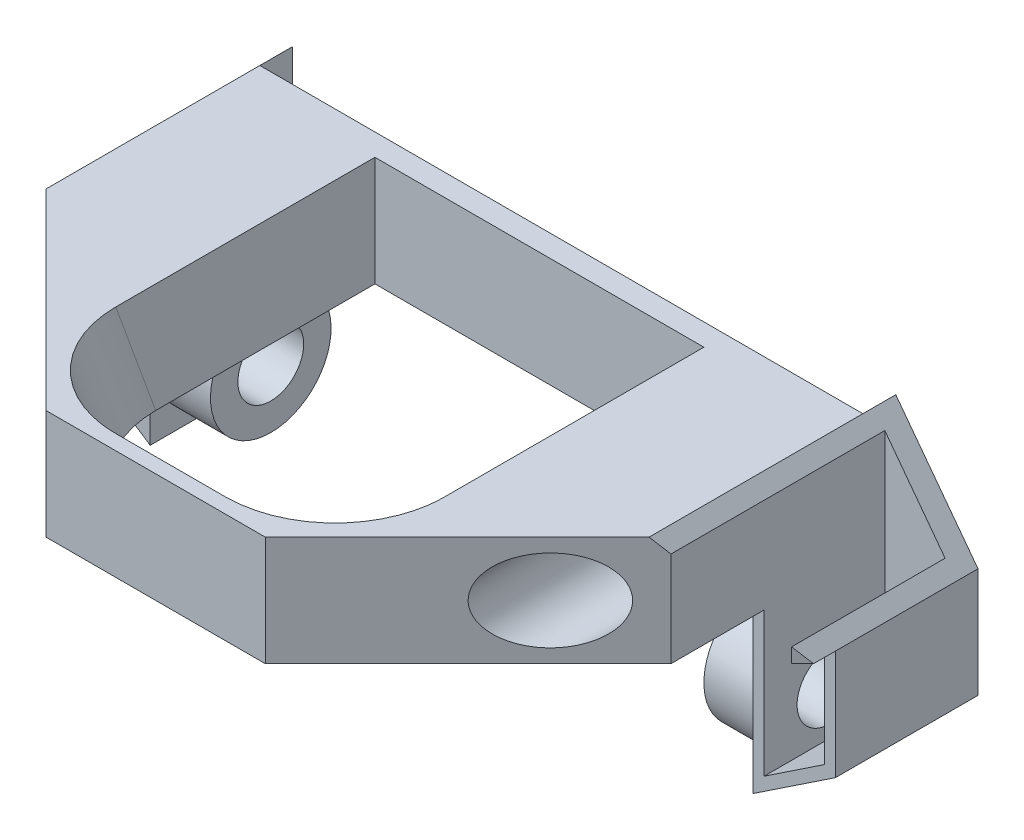
from build123d import *

# Parameters (mm, degrees)
BOSS_EXTRUDE1_DEPTH      = 40
CHAMFER1_SIZE            = 25
SKETCH3_W                = 55
SKETCH3_H                = 30.849850196
CUT_EXTRUDE2_DEPTH       = 3
SKETCH5_R                = 1.75
CUT_EXTRUDE4_DEPTH       = 56.226805086
CUT_EXTRUDE3_DEPTH       = 38
SKETCH6_R                = 5.5
SKETCH6_R_2              = 3
BOSS_EXTRUDE2_DEPTH      = 5
CUT_EXTRUDE5_START       = -2
SKETCH7_R                = 3
CUT_EXTRUDE5_DEPTH       = 2
SKETCH9_R                = 3.75
CUT_EXTRUDE7_DEPTH       = 24
SKETCH10_W               = 80.05733418
SKETCH10_H               = 23.210803027
CUT_EXTRUDE8_DEPTH       = 27
BOSS_EXTRUDE3_REACH      = 57.227
BOSS_EXTRUDE3_END_RADIUS = 5.5
SKETCH13_W               = 5
SKETCH13_H               = 8
SKETCH14_W               = 8.301356979
SKETCH14_H               = 17.411858477
CUT_EXTRUDE9_DEPTH       = 38
SKETCH15_W               = 30
SKETCH15_H               = 2
BOSS_EXTRUDE4_DEPTH      = 10


with BuildPart() as part:
    # Sketch1 → Boss-Extrude1 (new body)
    with BuildSketch(Plane.XY):
        Polygon((-27.5, 0), (27.5, 0), (27.5, -15), (35, -10), (35, 0), (27.5, 10), (-27.5, 10), (-35, 0), (-35, -10), (-27.5, -15), align=None)
    extrude(amount=BOSS_EXTRUDE1_DEPTH)

    # Chamfer1
    # the kernel refuses this chamfer: 25 mm, written as the material it takes off along each edge
    with BuildSketch(Plane(origin=(35, -74.292074699, 40), x_dir=(0.027495876610586317, 0, -0.9996219169112966), z_dir=(0, 1, 0)), Plane(origin=(-35, 64.292074699, 40), x_dir=(-0.027495876610586317, 0, -0.9996219169112966), z_dir=(0, -1, 0))) as chamfer1_piece_1:
        Polygon((CHAMFER1_SIZE * 0.999621916911, CHAMFER1_SIZE * 0.0274958766106), (-CHAMFER1_SIZE * 0.0274958766106, CHAMFER1_SIZE * 0.999621916911), (0, 0), align=None)
    extrude(amount=138.584149398, mode=Mode.SUBTRACT)

    # Sketch3 → Cut-Extrude2 (cut)
    with BuildSketch(Plane(origin=(0, 0, 0), x_dir=(-1, 0, 0), z_dir=(0, 0, -1))):
        Rectangle(SKETCH3_W, SKETCH3_H)
    extrude(amount=-CUT_EXTRUDE2_DEPTH, mode=Mode.SUBTRACT)

    # Sketch5 → Cut-Extrude4 (cut, through all)
    with BuildSketch(Plane(origin=(0, 0, 0), x_dir=(-1, 0, 0), z_dir=(0, 0, -1))):
        with Locations(Location((-23, 5, 0), (0, 0, 180))):
            Circle(SKETCH5_R)
        with Locations((23, 5)):
            Circle(SKETCH5_R)
    extrude(amount=-CUT_EXTRUDE4_DEPTH, mode=Mode.SUBTRACT)

    # Sketch4 → Cut-Extrude3 (cut)
    with BuildSketch(Plane.XY.offset(40)):
        Polygon((-34, 1.333333333), (-28.5, 8.666666667), (-28.5, -13.131482908), (-34, -9.464816242), align=None)
    cut_extrude3 = extrude(amount=-CUT_EXTRUDE3_DEPTH, mode=Mode.SUBTRACT)

    # Sketch6 → Boss-Extrude2 (add)
    with BuildSketch(Plane(origin=(-27.5, 0, 0), x_dir=(0, 0, -1), z_dir=(1, 0, 0))):
        with Locations(Location((-7, -9, 0), (0, 0, 180))):
            Circle(SKETCH6_R)
        with Locations((-7, -9)):
            Circle(SKETCH6_R_2, mode=Mode.SUBTRACT)
    boss_extrude2 = extrude(amount=BOSS_EXTRUDE2_DEPTH)

    # Sketch7 → Cut-Extrude5 (cut)
    with BuildSketch(Plane(origin=(-27.5, 0, 0), x_dir=(0, 0, -1), z_dir=(1, 0, 0)).offset(CUT_EXTRUDE5_START)):
        with Locations((-7, -9)):
            Circle(SKETCH7_R)
    cut_extrude5 = extrude(amount=CUT_EXTRUDE5_DEPTH, mode=Mode.SUBTRACT)

    # Mirror1: Cut-Extrude3, Boss-Extrude2, Cut-Extrude5 across plane
    add(cut_extrude3.mirror(Plane(origin=(0, 0, 0), x_dir=(0, 0, 1), z_dir=(1, 0, 0))), mode=Mode.SUBTRACT)
    add(boss_extrude2.mirror(Plane(origin=(0, 0, 0), x_dir=(0, 0, 1), z_dir=(1, 0, 0))))
    add(cut_extrude5.mirror(Plane(origin=(0, 0, 0), x_dir=(0, 0, 1), z_dir=(1, 0, 0))), mode=Mode.SUBTRACT)

    # Sketch9 → Cut-Extrude7 (cut)
    with BuildSketch(Plane.XY.offset(40)):
        with Locations((-23, 5)):
            Circle(SKETCH9_R)
        with Locations((23, 5)):
            Circle(SKETCH9_R)
    extrude(amount=-CUT_EXTRUDE7_DEPTH, mode=Mode.SUBTRACT)

    # Sketch10 → Cut-Extrude8 (cut)
    with BuildSketch(Plane.XY.offset(40)):
        with Locations((1.832814427, -11.605401514)):
            Rectangle(SKETCH10_W, SKETCH10_H)
    extrude(amount=-CUT_EXTRUDE8_DEPTH, mode=Mode.SUBTRACT)

    # Cut-Sweep1: sweep along a path in Sketch11
    with BuildLine(Plane(origin=(0, 0, 0), x_dir=(0, 0, -1), z_dir=(1, 0, 0))) as cut_sweep1_path:
        Line((0, 0), (-9.226976352, 25.350909176))
    # Sketch2 → Cut-Sweep1 (sweep, cut)
    with BuildSketch(Plane.XZ):
        with BuildLine():
            Line((-15, -35), (15, -35))
            Line((15, -35), (15, 25))
            ThreePointArc((15, 25), (12.071067812, 32.071067812), (5, 35))
            Line((5, 35), (-5, 35))
            ThreePointArc((-5, 35), (-12.071067812, 32.071067812), (-15, 25))
            Line((-15, 25), (-15, -35))
        make_face()
    sweep(path=cut_sweep1_path.line, mode=Mode.SUBTRACT)

    # Boss-Extrude3: up to this cylinder (the profile starts outside it)
    boss_extrude3_end = Plane(origin=(-25, -9, 7), z_dir=(-1, 0, 0)) * Cylinder(BOSS_EXTRUDE3_END_RADIUS, 126.454, mode=Mode.PRIVATE)
    # Sketch13 → Boss-Extrude3 (add, up to the surface)
    with BuildSketch(Plane.XZ, mode=Mode.PRIVATE) as boss_extrude3_sk1:
        with Locations((-25, 7)):
            Rectangle(SKETCH13_W, SKETCH13_H)
    boss_extrude3_tool1 = extrude(boss_extrude3_sk1.sketch, amount=BOSS_EXTRUDE3_REACH, mode=Mode.PRIVATE) - boss_extrude3_end
    add(boss_extrude3_tool1.solids().sort_by_distance((-25, 0, 7))[0])

    # Sketch14 → Cut-Extrude9 (cut)
    with BuildSketch(Plane.XY.offset(40)):
        with Locations((-38.15067849, -0.758887004)):
            Rectangle(SKETCH14_W, SKETCH14_H)
    extrude(amount=-CUT_EXTRUDE9_DEPTH, mode=Mode.SUBTRACT)

    # Sketch15 → Boss-Extrude4 (add)
    with BuildSketch(Plane(origin=(0, 10, 0), x_dir=(1, 0, 0), z_dir=(0, 1, 0))):
        with Locations((0, -4)):
            Rectangle(SKETCH15_W, SKETCH15_H)
    extrude(amount=-BOSS_EXTRUDE4_DEPTH)


solid = part.part
